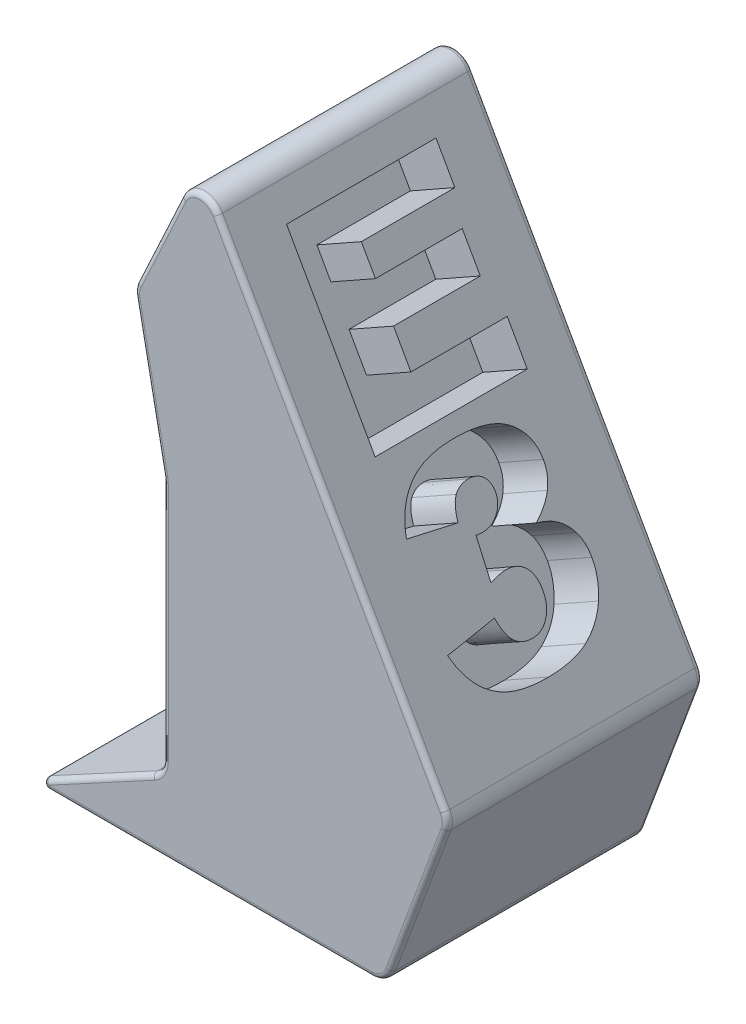
from build123d import *

# Parameters (mm, degrees)
BOSS_EXTRUDE4_DEPTH      = 250
BOSS_EXTRUDE4_DEPTH_BACK = 250
FILLET1_R                = 10
FILLET2_R                = 10
FILLET3_R                = 10
CUT_EXTRUDE1_DEPTH       = 100


with BuildPart() as part:
    # Sketch5 → Boss-Extrude4 (new, two sides: drawn at the far end of the back side and taken through both)
    with BuildSketch(Plane.XY.offset(-BOSS_EXTRUDE4_DEPTH_BACK)):
        with BuildLine():
            Line((0, 0), (672.171335821, 0))
            ThreePointArc((672.171335821, 0), (695.015340994, 7.164783727), (709.67572834, 26.092428616))
            Line((709.67572834, 26.092428616), (818.005303321, 318.223584322))
            ThreePointArc((818.005303321, 318.223584322), (820.376071762, 335.288930001), (815.348837324, 351.768416645))
            Line((815.348837324, 351.768416645), (740.331547095, 484.892737084))
            Line((740.331547095, 484.892737084), (370.482259657, 1141.220563707))
            ThreePointArc((370.482259657, 1141.220563707), (334.053202103, 1161.55204086), (299.344064495, 1138.4063941))
            Line((299.344064495, 1138.4063941), (211.46075369, 948.827148814))
            ThreePointArc((211.46075369, 948.827148814), (208.038304344, 936.789455071), (208.503214572, 924.283333024))
            Line((208.503214572, 924.283333024), (263.147839607, 646.500885254))
            ThreePointArc((263.147839607, 646.500885254), (263.711539672, 642.658800356), (263.900031848, 638.780160797))
            Line((263.900031848, 638.780160797), (263.900031848, 166.522987154))
            ThreePointArc((263.900031848, 166.522987154), (258.258035835, 146.04061517), (242.923653745, 131.336316241))
            Line((242.923653745, 131.336316241), (0, 0))
        make_face()
    extrude(amount=BOSS_EXTRUDE4_DEPTH + BOSS_EXTRUDE4_DEPTH_BACK)

    # Fillet1
    fillet1_edges = [part.edges().sort_by_distance(p)[0] for p in [
        (121.461826872, 65.66815812, 250),
        (336.085667911, 0, 250),
        (695.015340994, 7.164783727, 250),
        (763.840515831, 172.158006469, 250),
        (820.376071762, 335.288930001, 250),
        (592.91554849, 746.494490176, 250),
        (334.053202103, 1161.55204086, 250),
        (255.402409092, 1043.616771457, 250),
        (208.038304344, 936.789455071, 250),
        (235.825527089, 785.392109139, 250),
        (263.711539672, 642.658800356, 250),
        (263.900031848, 402.651573975, 250),
        (258.258035835, 146.04061517, 250),
    ]]
    fillet(fillet1_edges, radius=FILLET1_R)

    # Fillet2
    fillet2_edges = [part.edges().sort_by_distance(p)[0] for p in [
        (695.015340994, 7.164783727, -250),
        (763.840515831, 172.158006469, -250),
        (820.376071762, 335.288930001, -250),
        (592.91554849, 746.494490176, -250),
        (334.053202103, 1161.55204086, -250),
        (255.402409092, 1043.616771457, -250),
        (208.038304344, 936.789455071, -250),
        (235.825527089, 785.392109139, -250),
        (263.711539672, 642.658800356, -250),
        (121.461826872, 65.66815812, -250),
        (263.900031848, 402.651573975, -250),
        (258.258035835, 146.04061517, -250),
        (336.085667911, 0, -250),
    ]]
    fillet(fillet2_edges, radius=FILLET2_R)

    # Fillet3
    # the kernel refuses this fillet: 10 mm, written as the material it takes off along each edge
    with BuildSketch(Plane(origin=(39.52279504, 10, 240), x_dir=(0, -1, 0), z_dir=(0, 0, 1))) as fillet3_piece_1_section:
        Polygon((0, 0), (FILLET3_R, 0), (FILLET3_R, -FILLET3_R * 3.95227950403), (-FILLET3_R * 0.879666772827, -FILLET3_R * 0.475590547408), align=None)
    fillet3_piece_1 = extrude(amount=FILLET3_R, mode=Mode.PRIVATE)
    fillet3_piece_1 = fillet3_piece_1 - Plane(origin=(39.52279504, 10, 240), x_dir=(0.9694500432790283, 0.24528883706008733, 0), z_dir=(0, 0, 1)) * Sphere(FILLET3_R, mode=Mode.PRIVATE)
    add(fillet3_piece_1, mode=Mode.SUBTRACT)
    with BuildSketch(Plane(origin=(39.52279504, 10, -240), x_dir=(0, -1, 0), z_dir=(0, 0, -1))) as fillet3_piece_2_section:
        Polygon((0, 0), (FILLET3_R, 0), (FILLET3_R, FILLET3_R * 3.95227950403), (-FILLET3_R * 0.879666772827, FILLET3_R * 0.475590547408), align=None)
    fillet3_piece_2 = extrude(amount=FILLET3_R, mode=Mode.PRIVATE)
    fillet3_piece_2 = fillet3_piece_2 - Plane(origin=(39.52279504, 10, -240), x_dir=(0.9694500432790283, 0.24528883706008733, 0), z_dir=(0, 0, -1)) * Sphere(FILLET3_R, mode=Mode.PRIVATE)
    add(fillet3_piece_2, mode=Mode.SUBTRACT)
    with BuildSketch(Plane(origin=(0, 0, -240), x_dir=(1, 0, 0), z_dir=(0, 0, 1))) as fillet3_piece_3:
        with BuildLine():
            CenterArc((FILLET3_R * 3.95227950403, FILLET3_R), FILLET3_R, 118.397807475, 151.602192525)
            Line((FILLET3_R * 3.47668895662, FILLET3_R * 1.87966677283), (0, 0))
            Line((0, 0), (FILLET3_R * 3.95227950403, 0))
        make_face()
    extrude(amount=480, mode=Mode.SUBTRACT)

    # Sketch11 → Cut-Extrude1 (cut)
    with BuildSketch(Plane(origin=(769.289421626, 433.504619004, 0), x_dir=(0, 0, -1), z_dir=(0.8711981630321445, 0.4909315234627098, 0))):
        Polygon((-144.211144, 752.50763293), (148.55197, 752.50763293), (148.55197, 677.02589093), (-34.726412, 677.02589093), (-34.726412, 620.83659693), (135.288398, 620.83659693), (135.288398, 548.73101093), (-34.726412, 548.73101093), (-34.726412, 479.03698093), (153.857396, 479.03698093), (153.857396, 398.97330493), (-144.211144, 398.97330493), align=None)
        with BuildLine():
            Line((-51.366168, 257.313168), (-144.211144, 273.952938))
            add(Edge.make_bspline(
                [(-144.211144, 273.952938), (-136.494162, 303.534714), (-121.703274, 326.20336), (-99.838466, 341.958862)],
                knots=[0, 0, 0, 0, 1, 1, 1, 1], degree=3))
            add(Edge.make_bspline(
                [(-99.838466, 341.958862), (-77.812896, 357.714378), (-46.703804, 365.592122), (-6.511176, 365.592122)],
                knots=[0, 0, 0, 0, 1, 1, 1, 1], degree=3))
            add(Edge.make_bspline(
                [(-6.511176, 365.592122), (39.62994, 365.592122), (72.989812, 356.9909), (93.568468, 339.788456)],
                knots=[0, 0, 0, 0, 1, 1, 1, 1], degree=3))
            add(Edge.make_bspline(
                [(93.568468, 339.788456), (114.147082, 322.585998), (124.436396, 300.962382), (124.436396, 274.91758)],
                knots=[0, 0, 0, 0, 1, 1, 1, 1], degree=3))
            add(Edge.make_bspline(
                [(124.436396, 274.91758), (124.436396, 259.644378), (120.25636, 245.818104), (111.896288, 233.438772)],
                knots=[0, 0, 0, 0, 1, 1, 1, 1], degree=3))
            add(Edge.make_bspline(
                [(111.896288, 233.438772), (103.536216, 221.05944), (90.915734, 210.207438), (74.034828, 200.882752)],
                knots=[0, 0, 0, 0, 1, 1, 1, 1], degree=3))
            add(Edge.make_bspline(
                [(74.034828, 200.882752), (87.700312, 197.506554), (98.150402, 193.567668), (105.38507, 189.066094)],
                knots=[0, 0, 0, 0, 1, 1, 1, 1], degree=3))
            add(Edge.make_bspline(
                [(105.38507, 189.066094), (117.121312, 181.831426), (126.204848, 172.26559), (132.635664, 160.368586)],
                knots=[0, 0, 0, 0, 1, 1, 1, 1], degree=3))
            add(Edge.make_bspline(
                [(132.635664, 160.368586), (139.22727, 148.632316), (142.52308, 134.564906), (142.52308, 118.166328)],
                knots=[0, 0, 0, 0, 1, 1, 1, 1], degree=3))
            add(Edge.make_bspline(
                [(142.52308, 118.166328), (142.52308, 97.587686), (137.137266, 77.812896), (126.365638, 58.841986)],
                knots=[0, 0, 0, 0, 1, 1, 1, 1], degree=3))
            add(Edge.make_bspline(
                [(126.365638, 58.841986), (115.59401, 40.031838), (100.079658, 25.4821), (79.822582, 15.192814)],
                knots=[0, 0, 0, 0, 1, 1, 1, 1], degree=3))
            add(Edge.make_bspline(
                [(79.822582, 15.192814), (59.565478, 5.064276), (32.957946, 0), (0, 0)],
                knots=[0, 0, 0, 0, 1, 1, 1, 1], degree=3))
            add(Edge.make_bspline(
                [(0, 0), (-32.154108, 0), (-57.555834, 3.778096), (-76.205206, 11.334288)],
                knots=[0, 0, 0, 0, 1, 1, 1, 1], degree=3))
            add(Edge.make_bspline(
                [(-76.205206, 11.334288), (-94.693816, 18.890508), (-109.967018, 29.9033), (-122.024798, 44.372636)],
                knots=[0, 0, 0, 0, 1, 1, 1, 1], degree=3))
            add(Edge.make_bspline(
                [(-122.024798, 44.372636), (-133.92183, 59.002776), (-143.085754, 77.33061), (-149.51657, 99.356152)],
                knots=[0, 0, 0, 0, 1, 1, 1, 1], degree=3))
            Line((-149.51657, 99.356152), (-51.366168, 112.378574))
            add(Edge.make_bspline(
                [(-51.366168, 112.378574), (-47.50767, 92.603812), (-41.559154, 78.85794), (-33.520634, 71.140958)],
                knots=[0, 0, 0, 0, 1, 1, 1, 1], degree=3))
            add(Edge.make_bspline(
                [(-33.520634, 71.140958), (-25.321338, 63.584738), (-14.95165, 59.806628), (-2.411556, 59.806628)],
                knots=[0, 0, 0, 0, 1, 1, 1, 1], degree=3))
            add(Edge.make_bspline(
                [(-2.411556, 59.806628), (10.771628, 59.806628), (21.704032, 64.62974), (30.385642, 74.275978)],
                knots=[0, 0, 0, 0, 1, 1, 1, 1], degree=3))
            add(Edge.make_bspline(
                [(30.385642, 74.275978), (39.228028, 83.922202), (43.649214, 96.783848), (43.649214, 112.860888)],
                knots=[0, 0, 0, 0, 1, 1, 1, 1], degree=3))
            add(Edge.make_bspline(
                [(43.649214, 112.860888), (43.649214, 129.259494), (39.388804, 141.960364), (30.86797, 150.963498)],
                knots=[0, 0, 0, 0, 1, 1, 1, 1], degree=3))
            add(Edge.make_bspline(
                [(30.86797, 150.963498), (22.507898, 159.966632), (11.09318, 164.468206), (-3.376156, 164.468206)],
                knots=[0, 0, 0, 0, 1, 1, 1, 1], degree=3))
            add(Edge.make_bspline(
                [(-3.376156, 164.468206), (-11.093138, 164.468206), (-21.70399, 162.538964), (-35.208726, 158.680494)],
                knots=[0, 0, 0, 0, 1, 1, 1, 1], degree=3))
            Line((-35.208726, 158.680494), (-30.144478, 228.856796))
            add(Edge.make_bspline(
                [(-30.144478, 228.856796), (-24.678262, 228.052944), (-20.417838, 227.651018), (-17.363192, 227.651018)],
                knots=[0, 0, 0, 0, 1, 1, 1, 1], degree=3))
            add(Edge.make_bspline(
                [(-17.363192, 227.651018), (-4.501546, 227.651018), (6.189694, 231.75068), (14.710528, 239.94999)],
                knots=[0, 0, 0, 0, 1, 1, 1, 1], degree=3))
            add(Edge.make_bspline(
                [(14.710528, 239.94999), (23.39211, 248.149272), (27.732908, 257.875884), (27.732908, 269.129826)],
                knots=[0, 0, 0, 0, 1, 1, 1, 1], degree=3))
            add(Edge.make_bspline(
                [(27.732908, 269.129826), (27.732908, 279.901454), (24.5175, 288.502676), (18.086684, 294.933492)],
                knots=[0, 0, 0, 0, 1, 1, 1, 1], degree=3))
            add(Edge.make_bspline(
                [(18.086684, 294.933492), (11.655854, 301.364308), (2.813482, 304.57973), (-8.44046, 304.57973)],
                knots=[0, 0, 0, 0, 1, 1, 1, 1], degree=3))
            add(Edge.make_bspline(
                [(-8.44046, 304.57973), (-20.015912, 304.57973), (-29.420972, 301.04277), (-36.655654, 293.96885)],
                knots=[0, 0, 0, 0, 1, 1, 1, 1], degree=3))
            add(Edge.make_bspline(
                [(-36.655654, 293.96885), (-43.890322, 287.055734), (-48.793836, 274.837164), (-51.366168, 257.313168)],
                knots=[0, 0, 0, 0, 1, 1, 1, 1], degree=3))
        make_face()
    extrude(amount=-CUT_EXTRUDE1_DEPTH, mode=Mode.SUBTRACT)


solid = part.part
